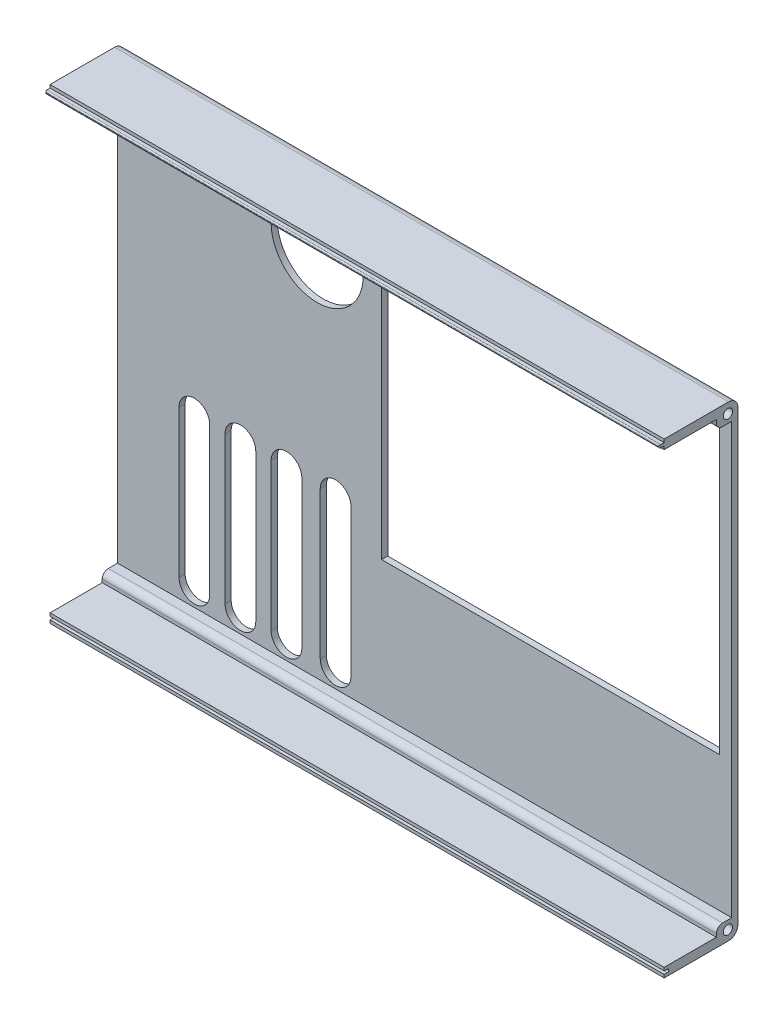
from build123d import *

# Parameters (mm, degrees)
SKETCH1_W                = 200
SKETCH1_H                = 152
BODY_DEPTH               = 2
SKETCH3_R                = 15
FAN_EXHAUST_GRILL_DEPTH  = 139.567397543
SKETCH12_W               = 200
SKETCH12_H               = 6
SIDE_WALLS_DEPTH         = 22
MOUNT_HOLES_L_DEPTH      = 221.789319628
MOUNT_HOLES_L_DEPTH_BACK = 10
SKETCH14_R               = 1.5
MOUNT_HOLES_R_START      = -10
SKETCH16_R               = 1.5
MOUNT_HOLES_R_DEPTH      = 10
SKETCH18_W               = 17
SKETCH18_H               = 3
WALL_REDUCE_DEPTH        = 221.789319628
SKETCH19_W               = 200
SKETCH19_H               = 1
GROOVE_DEPTH             = 1.5
SKETCH20_W               = 200
SKETCH20_H               = 1
NOTCH_DEPTH              = 1.5
SKETCH21_W               = 110
SKETCH21_H               = 95
BATT_CUT_DEPTH           = 141.531753216
FILLET1_R                = 3
FILLET2_R                = 2
FILLET3_R                = 0.4


with BuildPart() as part:
    # Sketch1 → body (new body)
    with BuildSketch(Plane.XY):
        with Locations((5, -14.39869281)):
            Rectangle(SKETCH1_W, SKETCH1_H)
    extrude(amount=BODY_DEPTH)

    # Sketch3 → fan_exhaust_grill (cut, through all)
    with BuildSketch(Plane(origin=(0, 0, 0), x_dir=(-1, 0, 0), z_dir=(0, 0, -1))):
        with Locations((30, 36.60130719)):
            Circle(SKETCH3_R)
        with BuildLine():
            Line((50, -78.39869281), (50, -30.39869281))
            ThreePointArc((50, -30.39869281), (55, -25.39869281), (60, -30.39869281))
            Line((60, -30.39869281), (60, -78.39869281))
            ThreePointArc((60, -78.39869281), (55, -83.39869281), (50, -78.39869281))
        make_face()
        with BuildLine():
            Line((65, -78.39869281), (65, -30.39869281))
            ThreePointArc((65, -30.39869281), (70, -25.39869281), (75, -30.39869281))
            Line((75, -30.39869281), (75, -78.39869281))
            ThreePointArc((75, -78.39869281), (70, -83.39869281), (65, -78.39869281))
        make_face()
        with BuildLine():
            Line((35, -78.39869281), (35, -30.39869281))
            ThreePointArc((35, -30.39869281), (40, -25.39869281), (45, -30.39869281))
            Line((45, -30.39869281), (45, -78.39869281))
            ThreePointArc((45, -78.39869281), (40, -83.39869281), (35, -78.39869281))
        make_face()
        with BuildLine():
            Line((19, -78.39869281), (19, -30.39869281))
            ThreePointArc((19, -30.39869281), (24, -25.39869281), (29, -30.39869281))
            Line((29, -30.39869281), (29, -78.39869281))
            ThreePointArc((29, -78.39869281), (24, -83.39869281), (19, -78.39869281))
        make_face()
    extrude(amount=-FAN_EXHAUST_GRILL_DEPTH, mode=Mode.SUBTRACT)

    # Sketch12 → side_walls (add)
    with BuildSketch(Plane.XY.offset(2)):
        with Locations((5, -87.39869281)):
            Rectangle(SKETCH12_W, SKETCH12_H)
        with Locations((5, 58.60130719)):
            Rectangle(SKETCH12_W, SKETCH12_H)
    extrude(amount=SIDE_WALLS_DEPTH)

    # Sketch14 → mount_holes_l (cut, two sides: drawn at the far end of the back side and taken through both)
    with BuildSketch(Plane(origin=(105, 0, 0), x_dir=(0, 0, -1), z_dir=(1, 0, 0)).offset(-MOUNT_HOLES_L_DEPTH_BACK)):
        with Locations((-3.25, -87.14869281)):
            Circle(SKETCH14_R)
        with Locations((-3.25, 58.35130719)):
            Circle(SKETCH14_R)
    extrude(amount=MOUNT_HOLES_L_DEPTH + MOUNT_HOLES_L_DEPTH_BACK, mode=Mode.SUBTRACT)

    # Sketch16 → mount_holes_r (cut)
    with BuildSketch(Plane.ZY.offset(95).offset(MOUNT_HOLES_R_START)):
        with Locations((3.25, -87.14869281)):
            Circle(SKETCH16_R)
        with Locations((3.25, 58.35130719)):
            Circle(SKETCH16_R)
    extrude(amount=MOUNT_HOLES_R_DEPTH, mode=Mode.SUBTRACT)

    # Sketch18 → wall_reduce (cut, through all)
    with BuildSketch(Plane(origin=(105, 0, 0), x_dir=(0, 0, -1), z_dir=(1, 0, 0))):
        with Locations((-15.5, -85.89869281)):
            Rectangle(SKETCH18_W, SKETCH18_H)
        with Locations((-15.5, 57.10130719)):
            Rectangle(SKETCH18_W, SKETCH18_H)
    extrude(amount=-WALL_REDUCE_DEPTH, mode=Mode.SUBTRACT)

    # Sketch19 → groove (cut)
    with BuildSketch(Plane.XY.offset(24)):
        with Locations((5, -88.89869281)):
            Rectangle(SKETCH19_W, SKETCH19_H)
    extrude(amount=-GROOVE_DEPTH, mode=Mode.SUBTRACT)

    # Sketch20 → notch (add)
    with BuildSketch(Plane.XY.offset(24)):
        with Locations((5, 60.10130719)):
            Rectangle(SKETCH20_W, SKETCH20_H)
    extrude(amount=NOTCH_DEPTH)

    # Sketch21 → batt_cut (cut, through all)
    with BuildSketch(Plane.XY.offset(2)):
        with Locations((46, 7.10130719)):
            Rectangle(SKETCH21_W, SKETCH21_H)
    extrude(amount=-BATT_CUT_DEPTH, mode=Mode.SUBTRACT)

    # Fillet1
    fillet1_edges = [part.edges().sort_by_distance(p)[0] for p in [
        (5, -90.39869281, 0),
        (5, 61.60130719, 0),
    ]]
    fillet(fillet1_edges, radius=FILLET1_R)

    # Fillet2
    fillet2_edges = [part.edges().sort_by_distance(p)[0] for p in [
        (5, -84.39869281, 7),
        (5, 55.60130719, 7),
    ]]
    fillet(fillet2_edges, radius=FILLET2_R)

    # Fillet3
    fillet3_edges = [part.edges().sort_by_distance(p)[0] for p in [
        (5, 60.60130719, 25.5),
        (105, 60.10130719, 25.5),
        (5, 59.60130719, 25.5),
        (-95, 60.10130719, 25.5),
        (5, -89.39869281, 22.5),
        (5, -88.39869281, 22.5),
    ]]
    fillet(fillet3_edges, radius=FILLET3_R)


solid = part.part
